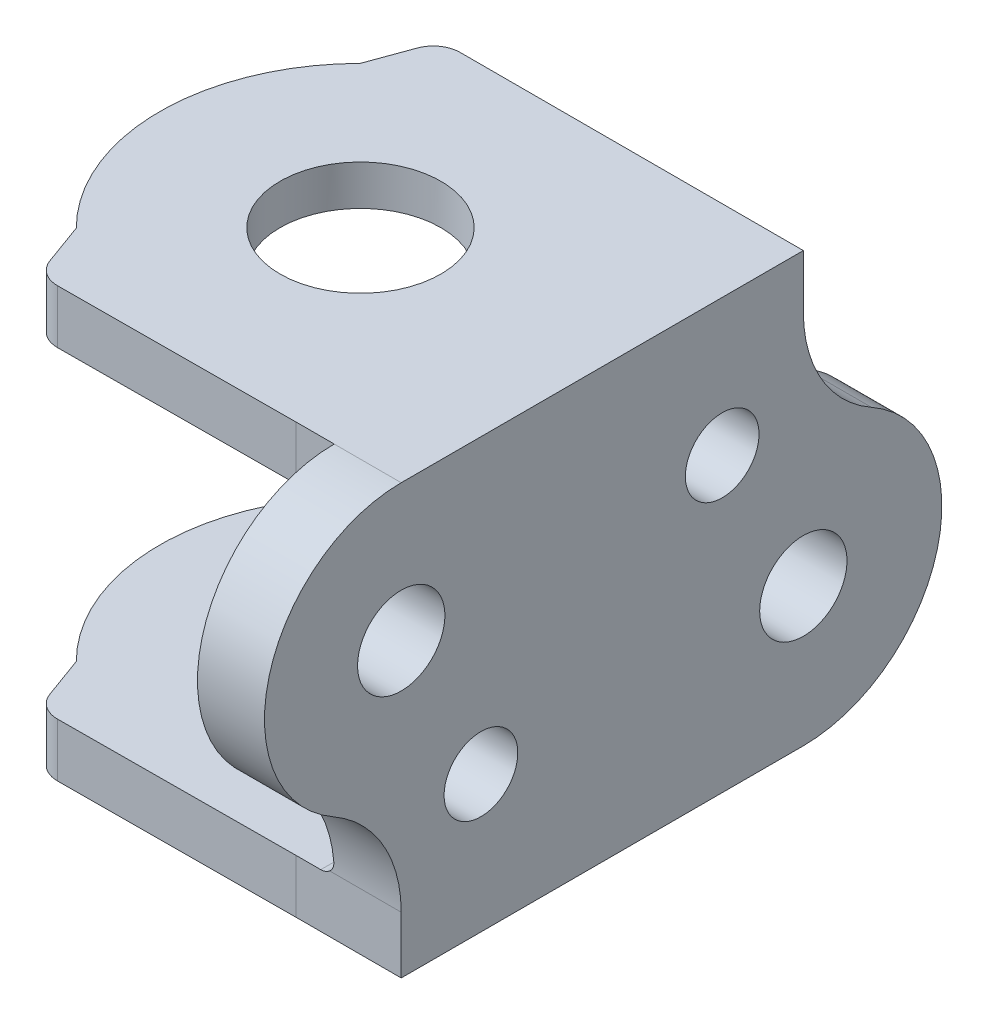
from build123d import *

# Parameters (mm, degrees)
SKETCH2_R               = 6
BOSS_EXTRUDE1_DEPTH     = 4
SKETCH3_W               = 5
SKETCH3_H               = 30
BOSS_EXTRUDE3_DEPTH     = 24
BOSS_EXTRUDE5_DEPTH     = 5
SKETCH7_3_R             = 3.25755
CUT_EXTRUDE3_DEPTH      = 5
FILLET3_R               = 10
CUT_EXTRUDE4_DEPTH      = 25
CUT_EXTRUDE4_DEPTH_BACK = 1
SKETCH8_R               = 7.5
CUT_EXTRUDE5_DEPTH      = 50.515905416
CUT_EXTRUDE5_DEPTH_BACK = 50.515905416
SKETCH9_R               = 2.75
FILLET4_R               = 1
BOSS_EXTRUDE6_DEPTH     = 4
FILLET6_R               = 2
BOSS_EXTRUDE7_DEPTH     = 4


with BuildPart() as part:
    # Sketch2 → Boss-Extrude1 (new body)
    with BuildSketch(Plane(origin=(0, 0, 0), x_dir=(1, 0, 0), z_dir=(0, 1, 0))):
        with BuildLine():
            Line((18.000912404, -14.946929254), (18.000912404, 15.053070746))
            Line((18.000912404, 15.053070746), (0.039090451, 15.053070746))
            ThreePointArc((0.039090451, 15.053070746), (-10.199781301, 11.024824414), (-14.94907539, 1.099832277))
            ThreePointArc((-14.94907539, 1.099832277), (-10.959209921, -10.21234771), (0.039090451, -15.000022662))
            Line((0.039090451, -15.000022662), (10.151696986, -14.946929254))
            Line((10.151696986, -14.946929254), (18.000912404, -14.946929254))
        make_face()
        with Locations(Location((0.000957071, 0.012970337, 0), (0, 0, 270))):
            Circle(SKETCH2_R, mode=Mode.SUBTRACT)
    boss_extrude1 = extrude(amount=BOSS_EXTRUDE1_DEPTH)

    # Sketch3 → Boss-Extrude3 (add)
    with BuildSketch(Plane(origin=(0, 4, 0), x_dir=(1, 0, 0), z_dir=(0, 1, 0))):
        with Locations((15.500912404, 0.053070746)):
            Rectangle(SKETCH3_W, SKETCH3_H)
    extrude(amount=BOSS_EXTRUDE3_DEPTH)

    # Mirror1: Boss-Extrude1 across plane
    add(boss_extrude1.mirror(Plane.ZX.offset(16)))

    # Sketch7 → Boss-Extrude5 (add)
    with BuildSketch(Plane.ZY.offset(-13.000912404)):
        with BuildLine():
            Line((-15.053070746, 0), (-15.053070746, 4))
            Line((-15.053070746, 4), (-15.053070746, 7.075913265))
            ThreePointArc((-15.053070746, 7.075913265), (-18.310620746, 10.333463265), (-15.053070746, 13.591013265))
            Line((-15.053070746, 13.591013265), (-15.053070746, 20.666926531))
            ThreePointArc((-15.053070746, 20.666926531), (-25.386534011, 10.333463265), (-15.053070746, 0))
        make_face()
        with BuildLine():
            ThreePointArc((25.146929254, 21.8), (22.159418422, 29.012489168), (14.946929254, 32))
            Line((14.946929254, 32), (14.946929254, 28))
            Line((14.946929254, 28), (14.946929254, 25.05755))
            ThreePointArc((14.946929254, 25.05755), (17.250364949, 24.103435695), (18.204479254, 21.8))
            ThreePointArc((18.204479254, 21.8), (17.250364949, 19.496564305), (14.946929254, 18.54245))
            Line((14.946929254, 18.54245), (14.946929254, 11.6))
            ThreePointArc((14.946929254, 11.6), (22.159418422, 14.587510832), (25.146929254, 21.8))
        make_face()
        with BuildLine():
            Line((14.946929254, 28), (14.946929254, 32))
            ThreePointArc((14.946929254, 32), (4.746929254, 21.8), (14.946929254, 11.6))
            Line((14.946929254, 11.6), (14.946929254, 18.54245))
            ThreePointArc((14.946929254, 18.54245), (11.689379254, 21.8), (14.946929254, 25.05755))
            Line((14.946929254, 25.05755), (14.946929254, 28))
        make_face()
    extrude(amount=-BOSS_EXTRUDE5_DEPTH)

    # Sketch7<3> → Cut-Extrude3 (cut)
    with BuildSketch(Plane.ZY.offset(-13.000912404)):
        with Locations((14.946929254, 21.8)):
            Circle(SKETCH7_3_R)
        with Locations((-15.053070746, 10.333463265)):
            Circle(SKETCH7_3_R)
    extrude(amount=-CUT_EXTRUDE3_DEPTH, mode=Mode.SUBTRACT)

    # Fillet3
    # the kernel refuses this fillet: 10 mm, written as the material it adds along each edge
    with BuildSketch(Plane(origin=(13.000912404, 20.666926531, -15.053070746), x_dir=(0, -0.25425566101904284, -0.9671370424297528), z_dir=(1, 0, 0))) as fillet3_piece_1:
        with BuildLine():
            CenterArc((7.797239676, 9.671370424), FILLET3_R, 194.729484057, 60.541031886)
            Line((-1.874130748, 7.128813814), (0, 0))
            ThreePointArc((0, 0), (2.627341533, 0.339588165), (5.254683066, 0))
        make_face()
    extrude(amount=5)
    with BuildSketch(Plane(origin=(13.000912404, 11.6, 14.946929254), x_dir=(0, -1, 0), z_dir=(1, 0, 0))) as fillet3_piece_2:
        with BuildLine():
            CenterArc((7.351068344, -10), FILLET3_R, 90, 60.326985198)
            ThreePointArc((-1.337579351, -5.04950495), (-0.340063626, -2.611829759), (0, 0))
            Line((0, 0), (7.351068344, 0))
        make_face()
    extrude(amount=5)

    # Sketch8 → Cut-Extrude4 (cut, two sides: drawn at the far end of the back side and taken through both)
    with BuildSketch(Plane(origin=(0, 4, 0), x_dir=(1, 0, 0), z_dir=(0, 1, 0)).offset(-CUT_EXTRUDE4_DEPTH_BACK)):
        with Locations(Location((0, 0, 0), (0, 0, 90))):
            Circle(SKETCH8_R)
    extrude(amount=CUT_EXTRUDE4_DEPTH + CUT_EXTRUDE4_DEPTH_BACK, mode=Mode.SUBTRACT)

    # Sketch9 → Cut-Extrude5 (cut, two sides: drawn at the far end of the back side and taken through both)
    with BuildSketch(Plane.ZY.offset(-13.000912404).offset(-CUT_EXTRUDE5_DEPTH_BACK)):
        with Locations((9, 10.2)):
            Circle(SKETCH9_R)
        with Locations((-9, 21.8)):
            Circle(SKETCH9_R)
    extrude(amount=CUT_EXTRUDE5_DEPTH + CUT_EXTRUDE5_DEPTH_BACK, mode=Mode.SUBTRACT)

    # Fillet4
    fillet4_edges = [part.edges().sort_by_distance(p)[0] for p in [
        (13.000912404, 4, -0.053070746),
        (13.000912404, 28, -0.053070746),
    ]]
    fillet(fillet4_edges, radius=FILLET4_R)

    # Sketch10 → Boss-Extrude6 (add)
    with BuildSketch(Plane.XZ):
        with BuildLine():
            ThreePointArc((0.039090451, -15.053070746), (-5.733491903, -13.900038334), (-10.620178824, -10.617892431))
            Line((-10.620178824, -10.617892431), (-9.005905934, -15.053070746))
            Line((-9.005905934, -15.053070746), (0.039090451, -15.053070746))
        make_face()
        with BuildLine():
            ThreePointArc((-10.571777141, 10.613334735), (-5.701848976, 13.860114152), (0.039090451, 15.000022662))
            Line((0.039090451, 15.000022662), (-8.957960629, 15.047259158))
            Line((-8.957960629, 15.047259158), (-10.571777141, 10.613334735))
        make_face()
    extrude(amount=-BOSS_EXTRUDE6_DEPTH)

    # Fillet6
    fillet6_edges = [part.edges().sort_by_distance(p)[0] for p in [
        (-9.005905934, 2, -15.053070746),
        (-8.957960629, 2, 15.047259158),
    ]]
    fillet(fillet6_edges, radius=FILLET6_R)

    # Sketch11 → Boss-Extrude7 (add)
    with BuildSketch(Plane(origin=(0, 32, 0), x_dir=(1, 0, 0), z_dir=(0, 1, 0))):
        with BuildLine():
            ThreePointArc((0.039090451, -15.000022662), (-5.701848976, -13.860114152), (-10.571777141, -10.613334735))
            Line((-10.571777141, -10.613334735), (-9.439611791, -13.723933469))
            ThreePointArc((-9.439611791, -13.723933469), (-8.703074785, -14.681202997), (-7.549726254, -15.039865618))
            Line((-7.549726254, -15.039865618), (0.039090451, -15.000022662))
        make_face()
        with BuildLine():
            Line((-9.484876099, 13.737111032), (-10.620178824, 10.617892431))
            ThreePointArc((-10.620178824, 10.617892431), (-5.733491903, 13.900038334), (0.039090451, 15.053070746))
            Line((0.039090451, 15.053070746), (-7.605490857, 15.053070746))
            ThreePointArc((-7.605490857, 15.053070746), (-8.75264373, 14.691374834), (-9.484876099, 13.737111032))
        make_face()
    extrude(amount=-BOSS_EXTRUDE7_DEPTH)


solid = part.part
